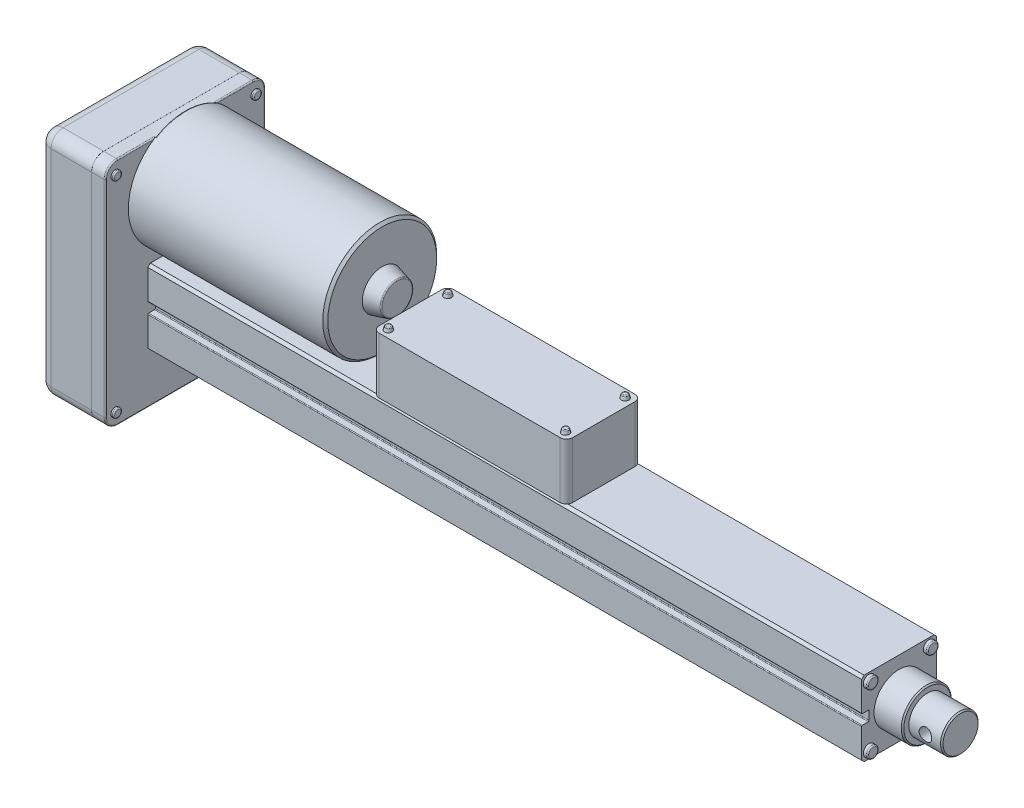
from build123d import *

# Parameters (mm, degrees)
SKETCH4_W                      = 362.712
SKETCH4_H                      = 38.1
BOSS_EXTRUDE1_DEPTH            = 19.05
SKETCH5_W                      = 100.076
SKETCH5_H                      = 28.956
SKETCH9_W                      = 81.28
SKETCH9_H                      = 117.094
BOSS_EXTRUDE3_DEPTH            = 33.782
SKETCH10_W                     = 98.40479938
SKETCH10_H                     = 28.575
BOSS_EXTRUDE4_DEPTH            = 19.05
CHAMFER1_SIZE                  = 1.27
FILLET1_R                      = 6.154862722
CHAMFER2_SIZE                  = 0.635
SKETCH13_R                     = 2.921
BOSS_EXTRUDE5_DEPTH            = 2.0828
FILLET2_R                      = 3.175
FILLET5_R                      = 0.635
FILLET8_R                      = 0.635
CUT_EXTRUDE1_DEPTH             = 449.791046755
CUT_EXTRUDE1_DEPTH_BACK        = 449.791046755
SKETCH16_R                     = 3.175
SKETCH21_R                     = 1.905
BOSS_EXTRUDE12_DEPTH           = 1.905
BOSS_EXTRUDE12_DRAFT           = 15
BOSS_EXTRUDE12_PROFILE_2_DEPTH = 1.905
BOSS_EXTRUDE12_PROFILE_2_DRAFT = 15
BOSS_EXTRUDE12_PROFILE_3_DEPTH = 1.905
BOSS_EXTRUDE12_PROFILE_3_DRAFT = 15
BOSS_EXTRUDE12_PROFILE_4_DEPTH = 1.905
BOSS_EXTRUDE12_PROFILE_4_DRAFT = 15
SKETCH23_R                     = 2.2225
BOSS_EXTRUDE13_DEPTH           = 1.27
BODY_MOVE_COPY5_ANGLE          = 180
SKETCH18_W                     = 29.718
SKETCH18_H                     = 8.636
BOSS_EXTRUDE9_DEPTH            = 5.08
FILLET13_R                     = 0.508
SKETCH27_R                     = 1.27
BOSS_EXTRUDE17_DEPTH           = 0.508
FILLET16_R                     = 0.381
CHAMFER3_SIZE                  = 1.27
SKETCH29_R                     = 10.16
BOSS_EXTRUDE18_DEPTH           = 7.62
BOSS_EXTRUDE18_TAPER           = 15
FILLET17_R                     = 0.635
CUT_EXTRUDE_THIN1_DEPTH        = 455.277704115
CUT_EXTRUDE_THIN1_DEPTH_BACK   = 455.277704115
SKETCH30_W                     = 0.0254
SKETCH30_H                     = 117.094
SKETCH31_W                     = 362.712
SKETCH31_H                     = 5.08
CUT_EXTRUDE2_DEPTH             = 3.81
FILLET18_R                     = 0.381


with BuildPart() as part:
    # Sketch3 → Revolve1 (revolve)
    with BuildSketch(Plane.XY, mode=Mode.PRIVATE) as revolve1_sk:
        Polygon((12.446, 15.875), (10.668, 15.875), (10.668, 9.525), (-8.382, 9.525), (-8.382, 0), (12.446, 0), align=None)
        Polygon((408.94, 12.7), (423.418, 12.7), (423.418, 9.525), (440.182, 9.525), (440.182, 0), (408.94, 0), align=None)
    revolve(revolve1_sk.sketch.rotate(Axis((-8.382, 0, 0), (1, 0, 0)), 90), axis=Axis((-8.382, 0, 0), (1, 0, 0)))

    # Sketch4 → Boss-Extrude1 (add, symmetric)
    with BuildSketch(Plane.XY):
        with Locations((227.584, 0)):
            Rectangle(SKETCH4_W, SKETCH4_H)
    extrude(amount=BOSS_EXTRUDE1_DEPTH, both=True)



with BuildPart() as body_2:
    # Sketch5 → Revolve2 (revolve)
    with BuildSketch(Plane.XY, mode=Mode.PRIVATE) as revolve2_sk:
        with Locations((96.266, 62.992)):
            Rectangle(SKETCH5_W, SKETCH5_H)
    revolve(revolve2_sk.sketch.rotate(Axis((46.228, 48.514, 0), (1, 0, 0)), 90), axis=Axis((46.228, 48.514, 0), (1, 0, 0)))


with BuildPart() as part_1:
    add(part.part)

    add(body_2.part)  # Boss-Extrude3 merges body 2
    # Sketch9 → Boss-Extrude3 (add)
    with BuildSketch(Plane(origin=(12.446, 0, 0), x_dir=(0, 0, -1), z_dir=(1, 0, 0))):
        with Locations((0, 14.605)):
            Rectangle(SKETCH9_W, SKETCH9_H)
    extrude(amount=BOSS_EXTRUDE3_DEPTH)

    # Chamfer1
    chamfer1_edges = [part_1.edges().sort_by_distance(p)[0] for p in [
        (227.584, 19.05, -19.05),
        (227.584, -19.05, -19.05),
        (227.584, 19.05, 19.05),
        (227.584, -19.05, 19.05),
    ]]
    chamfer(chamfer1_edges, length=CHAMFER1_SIZE)

    # Fillet1
    fillet1_edges = [part_1.edges().sort_by_distance(p)[0] for p in [
        (12.446, 14.605, -40.64),
        (29.337, -43.942, -40.64),
        (12.446, 73.152, 0),
        (29.337, 73.152, -40.64),
        (12.446, 14.605, 40.64),
        (29.337, 73.152, 40.64),
        (12.446, -43.942, 0),
        (29.337, -43.942, 40.64),
    ]]
    fillet(fillet1_edges, radius=FILLET1_R)

    # Chamfer2
    chamfer2_edges = [part_1.edges().sort_by_distance(p)[0] for p in [
        (-8.382, 0, -9.525),
        (440.182, 0, -9.525),
        (423.418, 0, -12.7),
    ]]
    chamfer(chamfer2_edges, length=CHAMFER2_SIZE)

    # Sketch13 → Boss-Extrude5 (add)
    with BuildSketch(Plane(origin=(408.94, 0, 0), x_dir=(0, 0, -1), z_dir=(1, 0, 0))):
        with Locations(Location((15.24, 15.24, 0), (0, 0, 180))):
            Circle(SKETCH13_R)
        with Locations(Location((-15.24, 15.24, 0), (0, 0, 180))):
            Circle(SKETCH13_R)
        with Locations(Location((15.24, -15.24, 0), (0, 0, 180))):
            Circle(SKETCH13_R)
        with Locations(Location((-15.24, -15.24, 0), (0, 0, 180))):
            Circle(SKETCH13_R)
    extrude(amount=BOSS_EXTRUDE5_DEPTH)

    # Fillet5
    # the kernel refuses this fillet: 0.635 mm, written as the material it takes off along each edge
    with BuildSketch(Plane(origin=(46.228, 48.514, 0), x_dir=(0, 0.8208040606132581, -0.5712098511762442), z_dir=(0, -0.5712098511762442, -0.8208040606132581))) as fillet5_piece_1_section:
        with BuildLine():
            CenterArc((28.956 - FILLET5_R, FILLET5_R), FILLET5_R, 270, 90)
            Line((28.956 - FILLET5_R, 0), (28.956, 0))
            Line((28.956, 0), (28.956, FILLET5_R))
        make_face()
    fillet5_piece_1 = revolve(axis=Axis((46.228, 48.514, 0), (1, 0, 0)), revolution_arc=69.66927103, mode=Mode.PRIVATE)
    fillet5_piece_1 = split(fillet5_piece_1, bisect_by=Plane(origin=(46.404118754, 73.152, 0), z_dir=(0, 1, 0)), keep=Keep.TOP, mode=Mode.PRIVATE)
    add(fillet5_piece_1, mode=Mode.SUBTRACT)

    # Fillet8
    fillet8_edges = [part_1.edges().sort_by_distance(p)[0] for p in [
        (46.228, 73.152, 24.848797862),
        (46.228, -43.942, 0),
        (46.228, 14.605, 40.64),
        (46.228, 14.605, -40.64),
        (46.228, 73.152, -24.848797862),
        (46.228, -42.139282446, -38.837282446),
        (46.228, 71.349282446, -38.837282446),
        (46.228, 71.349282446, 38.837282446),
        (46.228, -42.139282446, 38.837282446),
    ]]
    fillet(fillet8_edges, radius=FILLET8_R)

    # Sketch16 → Cut-Extrude1 (cut, two sides: drawn at the far end of the back side and taken through both)
    with BuildSketch(Plane.XY.offset(-CUT_EXTRUDE1_DEPTH_BACK)):
        Circle(SKETCH16_R)
        with Locations((431.8, 0)):
            Circle(SKETCH16_R)
    extrude(amount=CUT_EXTRUDE1_DEPTH + CUT_EXTRUDE1_DEPTH_BACK, mode=Mode.SUBTRACT)

    # Sketch23 → Boss-Extrude13 (add)
    with BuildSketch(Plane(origin=(46.228, 0, 0), x_dir=(0, 0, -1), z_dir=(1, 0, 0))):
        with Locations(Location((-35.56, -37.592, 0), (0, 0, 180))):
            Circle(SKETCH23_R)
        with Locations(Location((35.56, -37.592, 0), (0, 0, 180))):
            Circle(SKETCH23_R)
        with Locations(Location((35.56, 66.802, 0), (0, 0, 180))):
            Circle(SKETCH23_R)
        with Locations(Location((-35.56, 66.802, 0), (0, 0, 180))):
            Circle(SKETCH23_R)
    extrude(amount=BOSS_EXTRUDE13_DEPTH)

    # Sketch18 → Boss-Extrude9 (add)
    with BuildSketch(Plane.XZ.offset(19.05)):
        with Locations((67.437, 0)):
            Rectangle(SKETCH18_W, SKETCH18_H)
        with Locations((368.681, 0)):
            Rectangle(SKETCH18_W, SKETCH18_H)
    extrude(amount=BOSS_EXTRUDE9_DEPTH)

    # Sketch27 → Boss-Extrude17 (add)
    with BuildSketch(Plane.XZ.offset(24.13)):
        with Locations(Location((54.737, 0, 0), (0, 0, 270))):
            Circle(SKETCH27_R)
        with Locations(Location((80.137, 0, 0), (0, 0, 270))):
            Circle(SKETCH27_R)
        with Locations(Location((355.981, 0, 0), (0, 0, 270))):
            Circle(SKETCH27_R)
        with Locations(Location((381.381, 0, 0), (0, 0, 270))):
            Circle(SKETCH27_R)
    extrude(amount=BOSS_EXTRUDE17_DEPTH)

    # Fillet16
    fillet16_edges = [part_1.edges().sort_by_distance(p)[0] for p in [
        (52.578, -21.59, 4.318),
        (52.578, -21.59, -4.318),
        (82.296, -21.59, -4.318),
        (82.296, -21.59, 4.318),
        (52.578, -24.13, 0),
        (67.437, -24.13, -4.318),
        (82.296, -24.13, 0),
        (67.437, -24.13, 4.318),
        (353.822, -21.59, 4.318),
        (353.822, -21.59, -4.318),
        (383.54, -21.59, -4.318),
        (383.54, -21.59, 4.318),
        (353.822, -24.13, 0),
        (368.681, -24.13, -4.318),
        (383.54, -24.13, 0),
        (368.681, -24.13, 4.318),
        (80.137, -24.638, 1.27),
        (54.737, -24.638, 1.27),
        (355.981, -24.638, 1.27),
        (381.381, -24.638, 1.27),
    ]]
    fillet(fillet16_edges, radius=FILLET16_R)

    # Chamfer3
    chamfer3_edges = [part_1.edges().sort_by_distance(p)[0] for p in [
        (146.304, 48.514, -28.956),
    ]]
    chamfer(chamfer3_edges, length=CHAMFER3_SIZE)

    # Sketch29 → Boss-Extrude18 (add)
    with BuildSketch(Plane(origin=(146.304, 0, 0), x_dir=(0, 0, -1), z_dir=(1, 0, 0))):
        with Locations((0, 48.514)):
            Circle(SKETCH29_R)
    extrude(amount=BOSS_EXTRUDE18_DEPTH, taper=BOSS_EXTRUDE18_TAPER)

    # Fillet17
    fillet17_edges = [part_1.edges().sort_by_distance(p)[0] for p in [
        (411.0228, 15.24, -18.161),
        (411.0228, 15.24, 12.319),
        (411.0228, -15.24, -18.161),
        (411.0228, -15.24, 12.319),
        (47.498, -37.592, 33.3375),
        (47.498, -37.592, -37.7825),
        (47.498, 66.802, -37.7825),
        (47.498, 66.802, 33.3375),
        (153.924, 48.514, 8.118227154),
    ]]
    fillet(fillet17_edges, radius=FILLET17_R)

    # Sketch30 → Cut-Extrude-Thin1 (cut, two sides: drawn at the far end of the back side and taken through both)
    with BuildSketch(Plane.XY.offset(40.64).offset(-CUT_EXTRUDE_THIN1_DEPTH_BACK)):
        with Locations((39.2303, 14.605)):
            Rectangle(SKETCH30_W, SKETCH30_H)
    extrude(amount=CUT_EXTRUDE_THIN1_DEPTH + CUT_EXTRUDE_THIN1_DEPTH_BACK, mode=Mode.SUBTRACT)


with BuildPart() as body_2_2:
    # Sketch10 → Boss-Extrude4 (new, symmetric)
    with BuildSketch(Plane.XY):
        with Locations((99.930033058, -33.3375)):
            Rectangle(SKETCH10_W, SKETCH10_H)
    extrude(amount=BOSS_EXTRUDE4_DEPTH, both=True)

    # Fillet2
    fillet2_edges = [body_2_2.edges().sort_by_distance(p)[0] for p in [
        (149.132432748, -33.3375, 19.05),
        (50.727633368, -33.3375, 19.05),
        (149.132432748, -33.3375, -19.05),
        (50.727633368, -33.3375, -19.05),
    ]]
    fillet(fillet2_edges, radius=FILLET2_R)


with BuildPart() as boss_extrude12_tool:
    # Sketch21 → Boss-Extrude12 (with draft: the straight prism first)
    with BuildSketch(Plane.XZ.offset(47.625)):
        with Locations((144.96597254, 14.938994582)):
            Circle(SKETCH21_R)
    extrude(amount=BOSS_EXTRUDE12_DEPTH)
    # Boss-Extrude12: the draft: its side faces are tilted about the plane it starts from
    boss_extrude12_sides = [boss_extrude12_tool.faces().sort_by_distance(p)[0] for p in [
        (143.06097254, -48.5775, 14.938994582),
    ]]
    draft(boss_extrude12_sides, Plane.XZ.offset(47.625), BOSS_EXTRUDE12_DRAFT)


with BuildPart() as body_2_2_1:
    add(body_2_2.part)

    # Boss-Extrude12: add boss_extrude12_tool
    add(boss_extrude12_tool.part)


with BuildPart() as boss_extrude12_profile_2_tool:
    # Sketch21 → Boss-Extrude12 profile 2 (with draft: the straight prism first)
    with BuildSketch(Plane.XZ.offset(47.625)):
        with Locations((144.96597254, -15.2615766)):
            Circle(SKETCH21_R)
    extrude(amount=BOSS_EXTRUDE12_PROFILE_2_DEPTH)
    # Boss-Extrude12 profile 2: the draft: its side faces are tilted about the plane it starts from
    boss_extrude12_profile_2_sides = [boss_extrude12_profile_2_tool.faces().sort_by_distance(p)[0] for p in [
        (143.06097254, -48.5775, -15.2615766),
    ]]
    draft(boss_extrude12_profile_2_sides, Plane.XZ.offset(47.625), BOSS_EXTRUDE12_PROFILE_2_DRAFT)


with BuildPart() as body_2_2_2:
    add(body_2_2_1.part)

    # Boss-Extrude12 profile 2: add boss_extrude12_profile_2_tool
    add(boss_extrude12_profile_2_tool.part)


with BuildPart() as boss_extrude12_profile_3_tool:
    # Sketch21 → Boss-Extrude12 profile 3 (with draft: the straight prism first)
    with BuildSketch(Plane.XZ.offset(47.625)):
        with Locations((54.894093576, -15.2615766)):
            Circle(SKETCH21_R)
    extrude(amount=BOSS_EXTRUDE12_PROFILE_3_DEPTH)
    # Boss-Extrude12 profile 3: the draft: its side faces are tilted about the plane it starts from
    boss_extrude12_profile_3_sides = [boss_extrude12_profile_3_tool.faces().sort_by_distance(p)[0] for p in [
        (52.989093576, -48.5775, -15.2615766),
    ]]
    draft(boss_extrude12_profile_3_sides, Plane.XZ.offset(47.625), BOSS_EXTRUDE12_PROFILE_3_DRAFT)


with BuildPart() as body_2_2_3:
    add(body_2_2_2.part)

    # Boss-Extrude12 profile 3: add boss_extrude12_profile_3_tool
    add(boss_extrude12_profile_3_tool.part)


with BuildPart() as boss_extrude12_profile_4_tool:
    # Sketch21 → Boss-Extrude12 profile 4 (with draft: the straight prism first)
    with BuildSketch(Plane.XZ.offset(47.625)):
        with Locations((54.894093576, 14.938994582)):
            Circle(SKETCH21_R)
    extrude(amount=BOSS_EXTRUDE12_PROFILE_4_DEPTH)
    # Boss-Extrude12 profile 4: the draft: its side faces are tilted about the plane it starts from
    boss_extrude12_profile_4_sides = [boss_extrude12_profile_4_tool.faces().sort_by_distance(p)[0] for p in [
        (52.989093576, -48.5775, 14.938994582),
    ]]
    draft(boss_extrude12_profile_4_sides, Plane.XZ.offset(47.625), BOSS_EXTRUDE12_PROFILE_4_DRAFT)


with BuildPart() as body_2_2_4:
    add(body_2_2_3.part)

    # Boss-Extrude12 profile 4: add boss_extrude12_profile_4_tool
    add(boss_extrude12_profile_4_tool.part)


with BuildPart() as body_2_2_5:
    # Body-Move/Copy4: moved
    add(body_2_2_4.part.moved(Location((109.800366632, 63.5, 0))))


with BuildPart() as body_2_2_6:
    # Body-Move/Copy5: moved
    add(body_2_2_5.part.rotate(Axis((0, 31.75, 0), (1, 0, 0)), BODY_MOVE_COPY5_ANGLE))

    # Fillet13
    fillet13_edges = [body_2_2_6.edges().sort_by_distance(p)[0] for p in [
        (253.371782383, 49.53, 15.2615766),
        (163.29990342, 49.53, 15.2615766),
        (163.29990342, 49.53, -14.938994582),
        (253.371782383, 49.53, -14.938994582),
    ]]
    fillet(fillet13_edges, radius=FILLET13_R)


with BuildPart() as cut_extrude_thin1_piece_1:
    # of the separate pieces the step leaves, piece 1, a body of its own (cut_extrude_thin1_pieces)
    add(part_1.part.solids().sort_by_distance((46.863, -37.592, -33.3375))[0])

    # Sketch31 → Cut-Extrude2 (cut)
    with BuildSketch(Plane.XY.offset(19.05)):
        with Locations((227.584, 0)):
            Rectangle(SKETCH31_W, SKETCH31_H)
    extrude(amount=-CUT_EXTRUDE2_DEPTH, mode=Mode.SUBTRACT)

    # Fillet18
    fillet18_edges = [cut_extrude_thin1_piece_1.edges().sort_by_distance(p)[0] for p in [
        (227.584, 2.54, 15.24),
        (227.584, -2.54, 15.24),
        (227.584, -2.54, 19.05),
        (227.584, 2.54, 19.05),
    ]]
    fillet(fillet18_edges, radius=FILLET18_R)


with BuildPart() as cut_extrude_thin1_piece_2:
    # of the separate pieces the step leaves, piece 2, a body of its own (cut_extrude_thin1_pieces)
    add(part_1.part.solids().sort_by_distance((18.600862722, 73.152, -34.485137278))[0])


solid = Compound([body_2_2_6.part, cut_extrude_thin1_piece_1.part, cut_extrude_thin1_piece_2.part])
